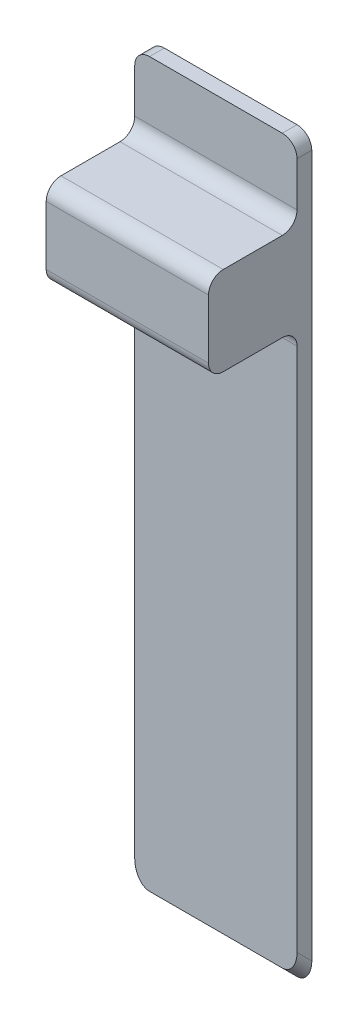
from build123d import *

# Parameters (mm, degrees)
SZKIC1_W                    = 11
SZKIC1_H                    = 50
DODANIE_WYCI_GNI_CIE1_DEPTH = 1
SFAZOWANIE1_SIZE            = 1
SZKIC2_W                    = 11
SZKIC2_H                    = 6
DODANIE_WYCI_GNI_CIE2_DEPTH = 6
ZAOKR_GLENIE1_R             = 1


with BuildPart() as part:
    # Szkic1 → Dodanie-wyciągnięcie1 (new body)
    with BuildSketch(Plane.XY):
        Rectangle(SZKIC1_W, SZKIC1_H)
    extrude(amount=DODANIE_WYCI_GNI_CIE1_DEPTH)

    # Sfazowanie1
    sfazowanie1_edges = [part.edges().sort_by_distance(p)[0] for p in [
        (0, -25, 1),
    ]]
    chamfer(sfazowanie1_edges, length=SFAZOWANIE1_SIZE - 0.0001)  # a hair under: the kernel refuses the full size

    # Szkic2 → Dodanie-wyciągnięcie2 (add)
    with BuildSketch(Plane.XY.offset(1)):
        with Locations((0, 17)):
            Rectangle(SZKIC2_W, SZKIC2_H)
    extrude(amount=DODANIE_WYCI_GNI_CIE2_DEPTH)

    # Zaokrąglenie1
    zaokr_glenie1_edges = [part.edges().sort_by_distance(p)[0] for p in [
        (5.5, -24.50005, 0.50005),
        (-5.5, -24.50005, 0.50005),
        (0, 14, 1),
        (0, 20, 1),
        (0, 14, 7),
        (0, 20, 7),
        (-5.5, 25, 0.5),
        (5.5, 25, 0.5),
    ]]
    fillet(zaokr_glenie1_edges, radius=ZAOKR_GLENIE1_R)


solid = part.part
